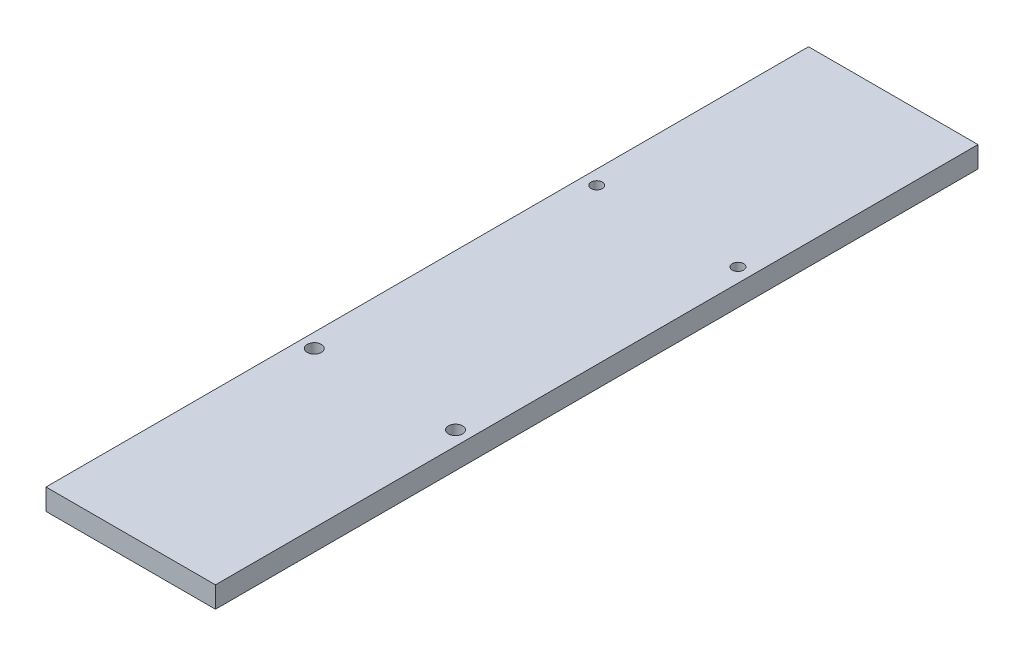
from build123d import *

# Parameters (mm, degrees)
SKETCH1_W           = 152.4
SKETCH1_H           = 685.8
BOSS_EXTRUDE1_DEPTH = 19.05
SKETCH2_R           = 5.08
SKETCH2_R_2         = 6.35
CUT_EXTRUDE1_DEPTH  = 703.787523011


with BuildPart() as part:
    # Sketch1 → Boss-Extrude1 (new body)
    with BuildSketch(Plane(origin=(0, 0, 0), x_dir=(1, 0, 0), z_dir=(0, 1, 0))):
        with Locations((76.2, 342.9)):
            Rectangle(SKETCH1_W, SKETCH1_H)
    extrude(amount=BOSS_EXTRUDE1_DEPTH)

    # Sketch2 → Cut-Extrude1 (cut, through all)
    with BuildSketch(Plane(origin=(0, 19.05, 0), x_dir=(1, 0, 0), z_dir=(0, 1, 0))):
        with Locations((12.7, 482.6)):
            Circle(SKETCH2_R)
        with Locations((139.7, 482.6)):
            Circle(SKETCH2_R)
        with Locations((12.7, 228.6)):
            Circle(SKETCH2_R_2)
        with Locations((139.7, 228.6)):
            Circle(SKETCH2_R_2)
    extrude(amount=-CUT_EXTRUDE1_DEPTH, mode=Mode.SUBTRACT)


solid = part.part
